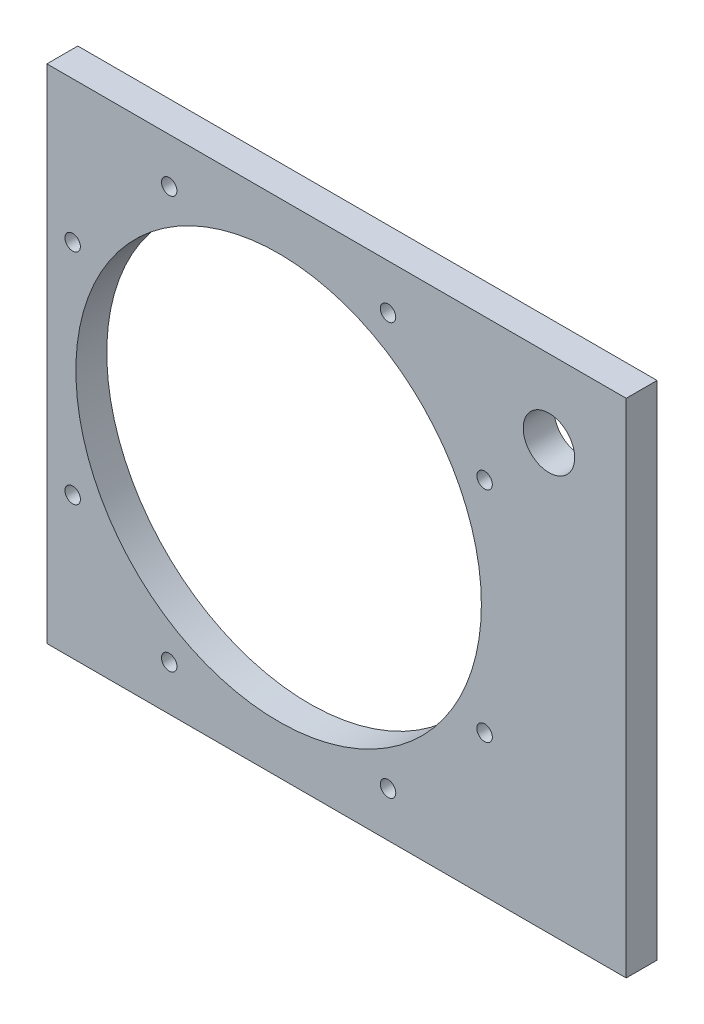
from build123d import *

# Parameters (mm, degrees)
SKETCH_1_W          = 450
SKETCH_1_H          = 390
SKETCH_1_R          = 157.5
SKETCH_1_R_2        = 6
SKETCH_1_R_3        = 20
EXTRUDE_1_DEPTH     = 24
SKETCH_2_R          = 4
CUT_EXTRUDE_1_DEPTH = 20


with BuildPart() as part:
    # 草图1 → 凸台-拉伸1 (new body)
    with BuildSketch(Plane.XY):
        Rectangle(SKETCH_1_W, SKETCH_1_H)
        with Locations((-45, 0)):
            Circle(SKETCH_1_R, mode=Mode.SUBTRACT)
        with Locations((-205, 85)):
            Circle(SKETCH_1_R_2, mode=Mode.SUBTRACT)
        with Locations((-205, -85)):
            Circle(SKETCH_1_R_2, mode=Mode.SUBTRACT)
        with Locations((40, 160)):
            Circle(SKETCH_1_R_2, mode=Mode.SUBTRACT)
        with Locations((-130, 160)):
            Circle(SKETCH_1_R_2, mode=Mode.SUBTRACT)
        with Locations((115, -85)):
            Circle(SKETCH_1_R_2, mode=Mode.SUBTRACT)
        with Locations((115, 85)):
            Circle(SKETCH_1_R_2, mode=Mode.SUBTRACT)
        with Locations((-130, -160)):
            Circle(SKETCH_1_R_2, mode=Mode.SUBTRACT)
        with Locations((40, -160)):
            Circle(SKETCH_1_R_2, mode=Mode.SUBTRACT)
        with Locations((165, 135)):
            Circle(SKETCH_1_R_3, mode=Mode.SUBTRACT)
    extrude(amount=EXTRUDE_1_DEPTH)

    # 草图2 → 切除-拉伸1 (cut)
    with BuildSketch(Plane(origin=(0, -195, 0), x_dir=(1, 0, 0), z_dir=(0, 1, 0))):
        with Locations((-155, -9.5)):
            Circle(SKETCH_2_R)
        with Locations((-25, -9.5)):
            Circle(SKETCH_2_R)
    extrude(amount=CUT_EXTRUDE_1_DEPTH, mode=Mode.SUBTRACT)


solid = part.part
